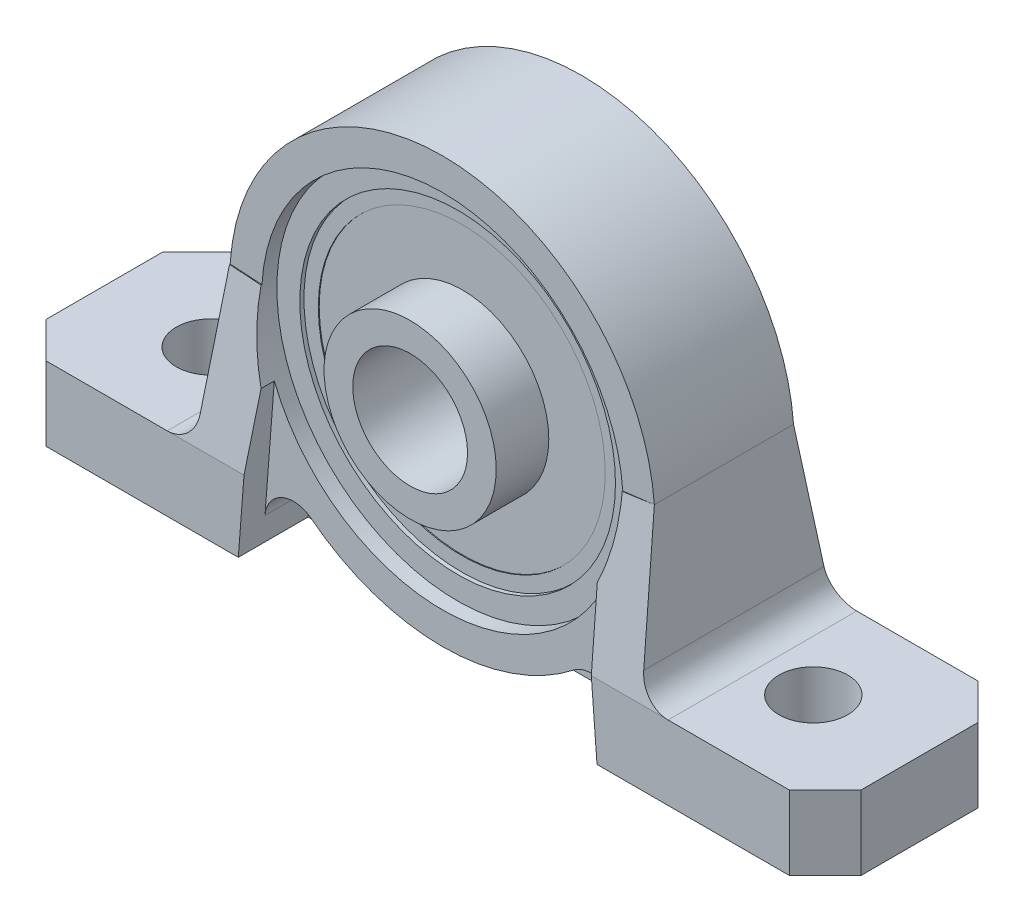
from build123d import *

# Parameters (mm, degrees)
BOSS_EXTRUDE1_DEPTH     = 6.575
SKETCH8_R               = 2.400000000000001
CUT_EXTRUDE3_DEPTH      = 39.155592587632775
CHAMFER1_SIZE           = 2.5
BOSS_EXTRUDE2_DEPTH     = 1.71
FILLET1_R               = 2
CUT_EXTRUDE4_DEPTH      = 1.725
CUT_EXTRUDE5_START      = -13.15
CUT_EXTRUDE5_DEPTH      = 1.725
CUT_EXTRUDE_THIN5_START = 7
CUT_EXTRUDE_THIN5_DEPTH = 26.81086056039093
CUT_EXTRUDE_THIN6_START = -7
CUT_EXTRUDE_THIN6_DEPTH = 26.81086056039093
FILLET2_R               = 2


# Read off the part's stored shape, not the designer's step: Cut-Extrude5
with BuildPart() as part:
    # Sketch1 → Revolve1 (revolve)
    with BuildSketch(Plane(origin=(0, 0, 0), x_dir=(0, 0, -1), z_dir=(1, 0, 0)), mode=Mode.PRIVATE) as revolve1_sk:
        Polygon((-7.0985121547008365, 5.999999999999999), (-3.4357973085956934, 6), (1.3e-15, 6), (3.4357973085956957, 6), (3.499999999999999, 6), (3.499999999999999, 4), (-7.0985121547008365, 3.999999999999999), align=None)
        Polygon((3.4357973085956957, 6), (1.3e-15, 6), (-3.4357973085956934, 6), (-3.4357973085956934, 9.999999999999998), (3.435797308595695, 9.999999999999998), align=None)
        Polygon((3.5000000000000013, 9.999999999999998), (3.435797308595695, 9.999999999999998), (-3.4357973085956934, 9.999999999999998), (-3.4999999999999996, 9.999999999999998), (-3.5000000000000018, 11), (-1.18e-15, 11), (3.499999999999999, 11), align=None)
        Polygon((3.789167362820558, 11), (3.499999999999999, 11), (-1.18e-15, 11), (-3.5000000000000018, 11), (-3.789167362820557, 11), (-3.789167362820557, 12.6), (5.8e-16, 12.6), (3.789167362820558, 12.6), align=None)
        Polygon((4.8500000000000005, 12.6), (3.789167362820558, 12.6), (5.8e-16, 12.6), (-3.789167362820557, 12.6), (-4.849999999999999, 12.6), (-4.849999999999999, 14.815), (0, 14.815), (4.8500000000000005, 14.815), align=None)
    revolve(revolve1_sk.sketch.rotate(Axis((0, 0, 11.627586075142245), (0, 0, -1)), 90), axis=Axis((0, 0, 11.627586075142245), (0, 0, -1)))

    # Sketch2 → Boss-Extrude1 (add, symmetric)
    with BuildSketch(Plane.XY):
        Polygon((28.402103283084184, -9.655000000000001), (15.601451795624948, -9.655000000000001), (12.102278163852397, -9.655000000000001), (12.500000000000004, -14.815000000000001), (28.402103283084184, -14.815), align=None)
        with BuildLine():
            ThreePointArc((14.771362958963898, 1.1362487995810626), (10.066049350023114, 10.87009086819882), (-3.5216e-13, 14.815000000000007))
            Line((0, 14.815000000000005), (0, 12.6))
            ThreePointArc((3.5261e-13, 12.600000000000001), (10.420944759538665, 7.082648538410167), (11.71553796349213, -4.6374745525959185))
            Line((11.71553796349213, -4.6374745525959185), (12.10227816385239, -9.655000000000001))
            Line((12.102278163852397, -9.655000000000001), (15.601451795624948, -9.655000000000001))
            Line((15.601451795624948, -9.655000000000001), (14.7713629589639, 1.1362487995810628))
        make_face()
        with BuildLine():
            Line((0, 12.6), (0, 14.815000000000005))
            ThreePointArc((-3.5216e-13, 14.815000000000007), (-10.066049350023373, 10.87009086819858), (-14.771362958963902, 1.136248799581064))
            Line((-14.7713629589639, 1.1362487995810628), (-15.601451795624941, -9.655000000000005))
            Line((-15.601451795624941, -9.655000000000005), (-12.10227816385239, -9.655000000000005))
            Line((-12.102278163852386, -9.655000000000005), (-11.71553796349213, -4.6374745525959185))
            ThreePointArc((-11.71553796349213, -4.637474552595917), (-10.420944759538465, 7.08264853841046), (3.5261e-13, 12.600000000000001))
        make_face()
        Polygon((-12.10227816385239, -9.655000000000005), (-15.601451795624941, -9.655000000000005), (-28.402103283084177, -9.655000000000006), (-28.402103283084177, -14.815000000000007), (-12.499999999999996, -14.815000000000005), align=None)
    extrude(amount=BOSS_EXTRUDE1_DEPTH, both=True)

    # Sketch8 → Cut-Extrude3 (cut, through all)
    with BuildSketch(Plane(origin=(0, -9.655000000000001, 0), x_dir=(1, 0, 0), z_dir=(0, 1, 0))):
        with Locations(Location((21.000000000000004, 0, 0), (0, 0, 270))):
            Circle(SKETCH8_R)
        with Locations(Location((-21.000000000000004, 0, 0), (0, 0, 90))):
            Circle(SKETCH8_R)
    extrude(amount=-CUT_EXTRUDE3_DEPTH, mode=Mode.SUBTRACT)

    # Chamfer1
    chamfer1_edges = [part.edges().sort_by_distance(p)[0] for p in [
        (-28.402103283084177, -12.235000000000007, -6.575),
        (28.402103283084184, -12.235, 6.575),
        (-28.402103283084177, -12.235000000000007, 6.575),
        (28.402103283084184, -12.235, -6.575),
    ]]
    chamfer(chamfer1_edges, length=CHAMFER1_SIZE)

    # Sketch9 → Boss-Extrude2 (add, symmetric)
    with BuildSketch(Plane.XY):
        with BuildLine():
            Line((-12.499999999999996, -14.815000000000007), (12.500000000000004, -14.815000000000001))
            Line((12.500000000000004, -14.815000000000001), (11.715537963492132, -4.637474552595919))
            ThreePointArc((11.715537963492132, -4.637474552595919), (-9.9e-16, -12.600000000000003), (-11.71553796349213, -4.6374745525959185))
            Line((-11.71553796349213, -4.6374745525959185), (-12.499999999999996, -14.815000000000007))
        make_face()
    extrude(amount=BOSS_EXTRUDE2_DEPTH, both=True)

    # Fillet1
    fillet1_edges = [part.edges().sort_by_distance(p)[0] for p in [
        (12.025078643317716, -8.653421786901651, -3.2800000000000002),
        (-12.025078643317713, -8.653421786901657, -3.2800000000000002),
        (-12.025078643317713, -8.653421786901657, 3.2799999999999994),
        (12.025078643317716, -8.653421786901651, 3.2799999999999994),
    ]]
    fillet(fillet1_edges, radius=FILLET1_R)

    # Sketch13 → Cut-Extrude4 (cut)
    with BuildSketch(Plane.XY.offset(6.575)):
        Polygon((-11.889993926761807, 0.705696375939659), (-17.610193659545324, 1.0452023711437894), (-14.425824047946865, 15.189187645015892), (3.1299229448728054, 17.38365601911835), (21.41715939572663, 11.678038246451958), (16.784392828177, 1.3884198701048673), (11.94080724759393, 0.7829716725319836), (0.5940928236877405, 11.678038246451958), align=None)
    extrude(amount=-CUT_EXTRUDE4_DEPTH, mode=Mode.SUBTRACT)

    # Cut-Extrude5 outline → Cut-Extrude5 (cut)
    with BuildSketch(Plane.XY.offset(6.575).offset(CUT_EXTRUDE5_START)):
        with BuildLine():
            Line((-14.791236442, 0.877891277), (-12.577865613, 0.746523021))
            ThreePointArc((-12.577865613, 0.746523021), (-0.057697816, 12.599867895), (12.57050125, 0.861683423))
            Line((12.57050125, 0.861683423), (14.771321629, 1.13678597))
            ThreePointArc((14.771321629, 1.13678597), (-0.000269379, 14.814999998), (-14.771362959, 1.1362488))
            Line((-14.771362959, 1.1362488), (-14.791236442, 0.877891277))
        make_face()
    extrude(amount=CUT_EXTRUDE5_DEPTH, mode=Mode.SUBTRACT)

    # Sketch14 → Cut-Extrude-Thin5 (cut, through all)
    with BuildSketch(Plane(origin=(0, 0, 0), x_dir=(0, 0, -1), z_dir=(1, 0, 0)).offset(CUT_EXTRUDE_THIN5_START)):
        Polygon((-4.849999999999999, 1.1367859701682461), (-6.575, -9.655000000000001), (-16.449646842920206, -8.076598996577228), (-14.724646842920205, 2.7151869735910195), align=None)
        Polygon((6.575, -9.655000000000001), (4.8500000000000005, 1.1367859701682461), (14.724646842920205, 2.7151869735910177), (16.449646842920206, -8.07659899657723), align=None)
    extrude(amount=CUT_EXTRUDE_THIN5_DEPTH, mode=Mode.SUBTRACT)

    # Sketch14<2> → Cut-Extrude-Thin6 (cut, through all)
    with BuildSketch(Plane(origin=(0, 0, 0), x_dir=(0, 0, -1), z_dir=(1, 0, 0)).offset(CUT_EXTRUDE_THIN6_START)):
        Polygon((-4.849999999999999, 1.1367859701682461), (-6.575, -9.655000000000001), (-16.449646842920206, -8.076598996577228), (-14.724646842920205, 2.7151869735910195), align=None)
        Polygon((6.575, -9.655000000000001), (4.8500000000000005, 1.1367859701682461), (14.724646842920205, 2.7151869735910177), (16.449646842920206, -8.07659899657723), align=None)
    extrude(amount=-CUT_EXTRUDE_THIN6_DEPTH, mode=Mode.SUBTRACT)

    # Fillet2
    fillet2_edges = [part.edges().sort_by_distance(p)[0] for p in [
        (15.601451795624948, -9.655000000000001, 0),
        (-15.601451795624941, -9.655000000000005, 0),
    ]]
    fillet(fillet2_edges, radius=FILLET2_R)


solid = part.part
